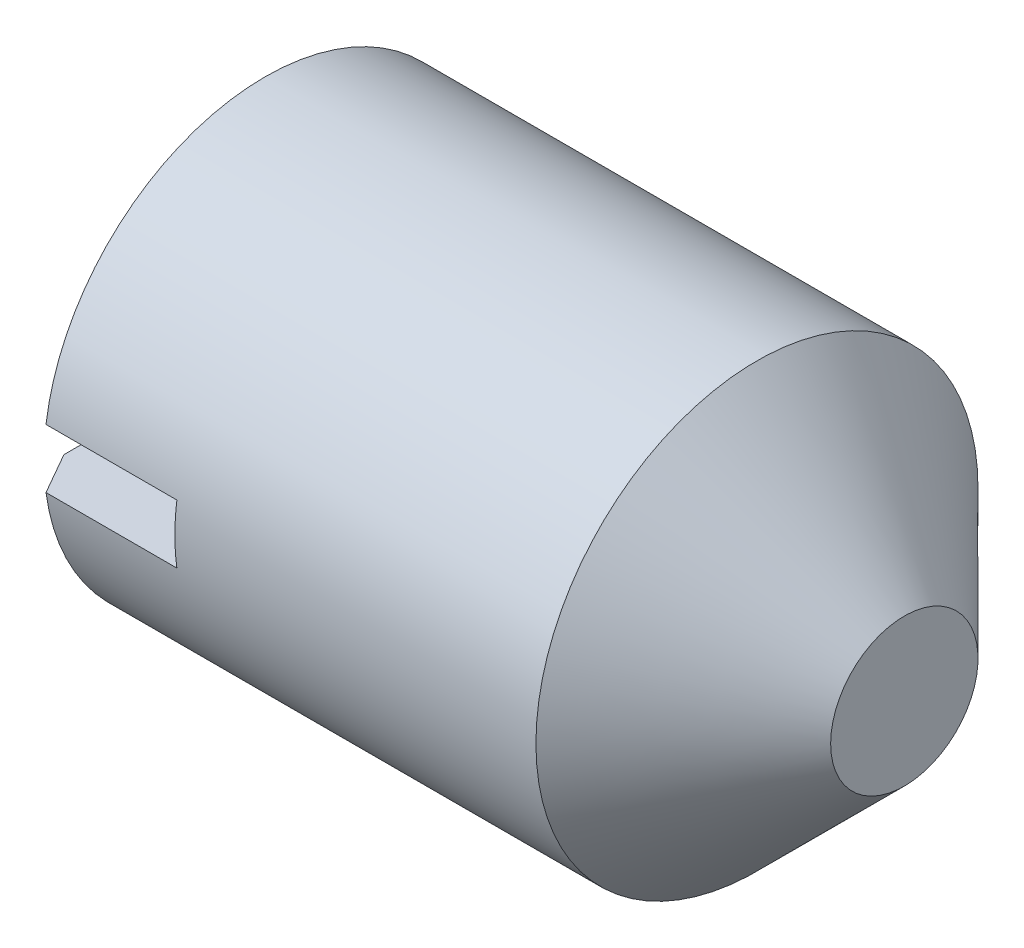
from build123d import *

# Parameters (mm, degrees)
BASEBODY_DEPTH               = 5.0000001
BASEBODY_START               = 1.05
BASEBODY_2_DEPTH             = 3.9500001
ENL_V_MAT_EXTRU_1_DEPTH      = 6.431390246
ENL_V_MAT_EXTRU_1_DEPTH_BACK = 6.431390246
ESQUISSE1_W                  = 0.922934363
ESQUISSE1_H                  = 1.901467182


with BuildPart() as part:
    # BaseBody: read off the stored shape, not the designer's step
    # BaseBody outline → BaseBody (new body)
    with BuildSketch(Plane.YZ):
        with BuildLine():
            ThreePointArc((0.2, -1.486606875), (1.5, 0), (0.2, 1.486606875))
            Line((0.2, 1.486606875), (0.2, -1.486606875))
        make_face()
        with BuildLine():
            Line((-0.2, -1.486606875), (-0.2, 1.486606875))
            ThreePointArc((-0.2, 1.486606875), (-1.5, 0), (-0.2, -1.486606875))
        make_face()
    extrude(amount=BASEBODY_DEPTH)

    # BaseBody 2 outline → BaseBody 2 (add)
    with BuildSketch(Plane.YZ.offset(BASEBODY_START)):
        with BuildLine():
            Line((0.2, -1.486606875), (0.2, 1.486606875))
            ThreePointArc((0.2, 1.486606875), (0, 1.5), (-0.2, 1.486606875))
            Line((-0.2, 1.486606875), (-0.2, -1.486606875))
            ThreePointArc((-0.2, -1.486606875), (0, -1.5), (0.2, -1.486606875))
        make_face()
    extrude(amount=BASEBODY_2_DEPTH)

    # BaseBody 3 outline → BaseBody 3 (revolve, cut)
    with BuildSketch(Plane.YX):
        Polygon((1.500000003, 0.161946752), (1.21949999, -6e-09), (1.500000003, -6e-09), align=None)
        Polygon((0, 5), (1.5, 3.5), (1.500000003, 5.0000001), align=None)
    revolve(axis=Axis((0, 0, 0), (1, 0, 0)), mode=Mode.SUBTRACT)

    # Esquisse1 → Enlèv. mat.-Extru.1 (cut, two sides: drawn at the far end of the back side and taken through both)
    with BuildSketch(Plane(origin=(0, 0, 0), x_dir=(1, 0, 0), z_dir=(0, 1, 0)).offset(-ENL_V_MAT_EXTRU_1_DEPTH_BACK)):
        with Locations((4.961467181, -0.061158301)):
            Rectangle(ESQUISSE1_W, ESQUISSE1_H)
    extrude(amount=ENL_V_MAT_EXTRU_1_DEPTH + ENL_V_MAT_EXTRU_1_DEPTH_BACK, mode=Mode.SUBTRACT)


solid = part.part
